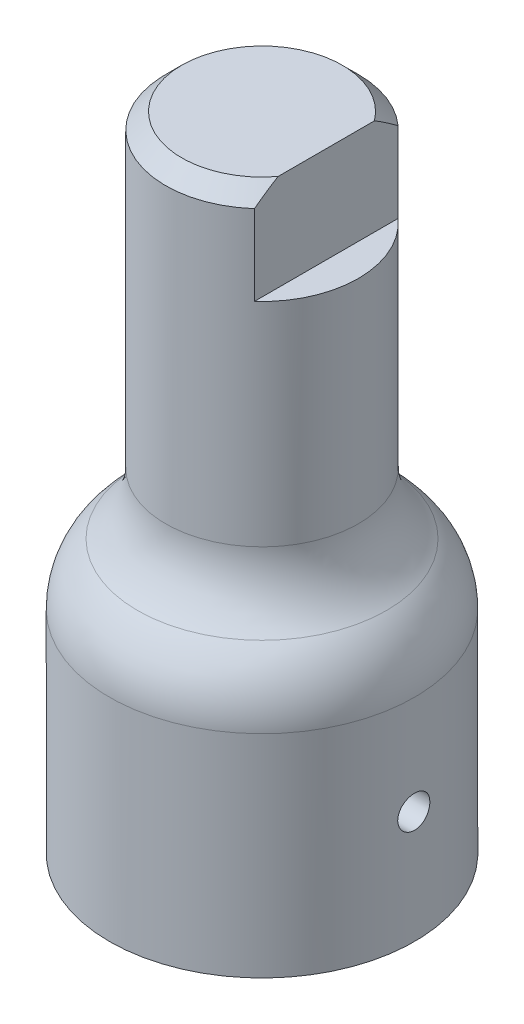
from build123d import *

# Parameters (mm, degrees)
SKETCH1_R               = 9.5
SKETCH1_R_2             = 6
BOSS_EXTRUDE1_DEPTH     = 16
BOSS_EXTRUDE2_START     = 14
BOSS_EXTRUDE2_DEPTH     = 26
BOSS_EXTRUDE5_START     = 14
BOSS_EXTRUDE5_DEPTH     = 20
CUT_EXTRUDE1_REACH      = 44.196
CUT_EXTRUDE1_END_RADIUS = 9.5
SKETCH2_R               = 1
CHAMFER1_SIZE           = 1
FILLET2_R               = 5
FILLET3_R               = 5


with BuildPart() as part:
    # Sketch1 → Boss-Extrude1 (new body)
    with BuildSketch(Plane(origin=(0, 0, 0), x_dir=(1, 0, 0), z_dir=(0, 1, 0))):
        with Locations(Location((0, 0, 0), (0, 0, 270))):
            Circle(SKETCH1_R)
        with Locations(Location((0, 0, 0), (0, 0, 270))):
            Circle(SKETCH1_R_2, mode=Mode.SUBTRACT)
    extrude(amount=BOSS_EXTRUDE1_DEPTH)



with BuildPart() as body_2:
    # Sketch1<3> → Boss-Extrude2 (new body)
    with BuildSketch(Plane(origin=(0, 0, 0), x_dir=(1, 0, 0), z_dir=(0, 1, 0)).offset(BOSS_EXTRUDE2_START)):
        with BuildLine():
            Line((4, -4.472135955), (4, 4.472135955))
            ThreePointArc((4, 4.472135955), (-6, 0), (4, -4.472135955))
        make_face()
    extrude(amount=BOSS_EXTRUDE2_DEPTH)


with BuildPart() as part_1:
    add(part.part)

    add(body_2.part)  # Boss-Extrude5 merges body 2
    # Sketch1<5> → Boss-Extrude5 (add)
    with BuildSketch(Plane(origin=(0, 0, 0), x_dir=(1, 0, 0), z_dir=(0, 1, 0)).offset(BOSS_EXTRUDE5_START)):
        with BuildLine():
            ThreePointArc((6, 0), (5.477225575, 2.449489743), (4, 4.472135955))
            Line((4, 4.472135955), (4, -4.472135955))
            ThreePointArc((4, -4.472135955), (5.477225575, -2.449489743), (6, 0))
        make_face()
        with BuildLine():
            Line((4, -4.472135955), (4, 4.472135955))
            ThreePointArc((4, 4.472135955), (-6, 0), (4, -4.472135955))
        make_face()
    extrude(amount=BOSS_EXTRUDE5_DEPTH)

    # Cut-Extrude1: up to this cylinder (the profile starts inside it)
    cut_extrude1_end = Plane(origin=(0, 7, 0), z_dir=(0, -1, 0)) * Cylinder(CUT_EXTRUDE1_END_RADIUS, 108.392, mode=Mode.PRIVATE)
    # Sketch2 → Cut-Extrude1 (cut, up to the surface)
    with BuildSketch(Plane(origin=(0, 0, 0), x_dir=(0, 0, -1), z_dir=(1, 0, 0)), mode=Mode.PRIVATE) as cut_extrude1_sk1:
        with Locations(Location((0, 7, 0), (0, 0, 180))):
            Circle(SKETCH2_R)
    cut_extrude1_tool1 = extrude(cut_extrude1_sk1.sketch, amount=CUT_EXTRUDE1_REACH, mode=Mode.PRIVATE) & cut_extrude1_end
    add(cut_extrude1_tool1.solids().sort_by_distance((0, 7, 0))[0], mode=Mode.SUBTRACT)

    # Chamfer1
    chamfer1_edges = [part_1.edges().sort_by_distance(p)[0] for p in [
        (-6, 40, 0),
    ]]
    chamfer(chamfer1_edges, length=CHAMFER1_SIZE)

    # Fillet2
    # the kernel refuses this fillet: 5 mm, written as the material it adds along each edge
    with BuildSketch(Plane(origin=(0, 16, 0), x_dir=(0.6666666666667012, 0, -0.745355992499899), z_dir=(-0.745355992499899, 0, -0.6666666666667012))) as fillet2_piece_1:
        with BuildLine():
            CenterArc((11, -4.769696007), FILLET2_R, 107.457603124, 72.542396876)
            Line((9.5, 0), (9.47, 0.09539392))
            ThreePointArc((9.47, 0.09539392), (7.75, 0.1), (6, 0.1))
            Line((6, 0.1), (5.9, 0))
            Line((5.9, 0), (5.9, -4.769696007))
            Line((5.9, -4.769696007), (6, -4.769696007))
        make_face()
    revolve(axis=Axis((0, 16, 0), (0, -1, 0)))

    # Fillet3
    fillet3_edges = [part_1.edges().sort_by_distance(p)[0] for p in [
        (8.87463741, 16, 3.389809853),
    ]]
    fillet(fillet3_edges, radius=FILLET3_R)


solid = part_1.part
